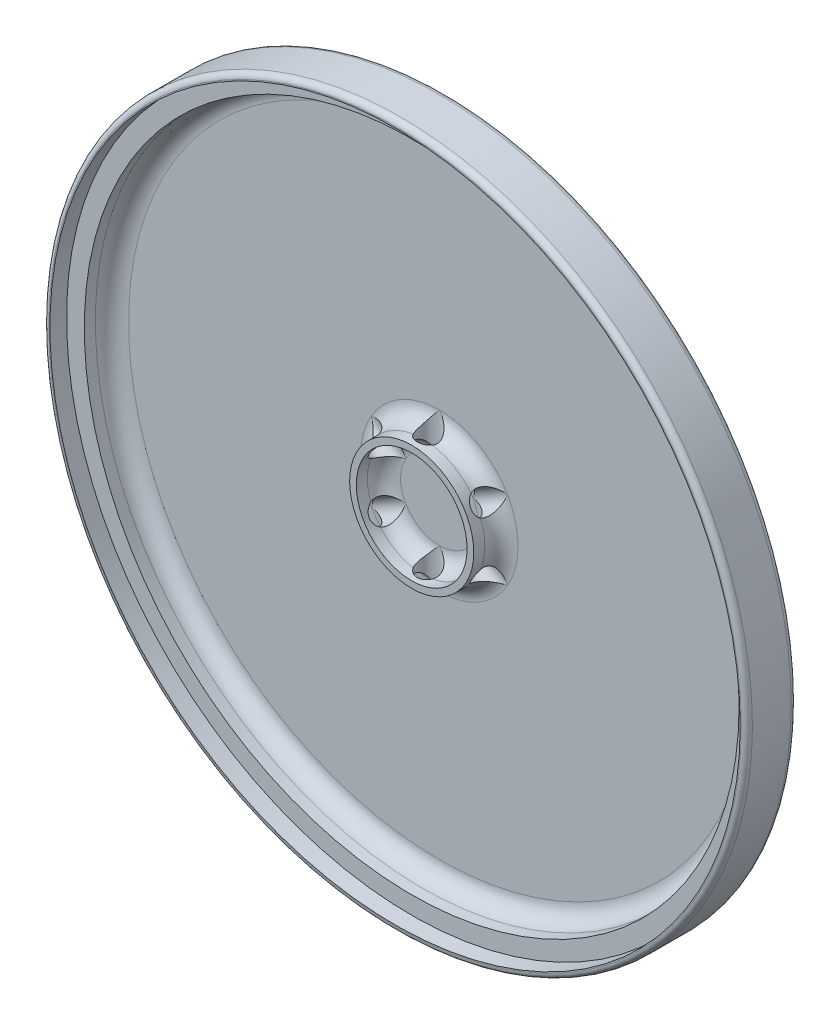
from build123d import *

# Parameters (mm, degrees)
SKETCH1_R                      = 63.5
SKETCH1_R_2                    = 62.3
SKETCH1_R_3                    = 59.1
SKETCH1_R_4                    = 11.2
SKETCH1_R_5                    = 10
BOSS_EXTRUDE1_DEPTH            = 1
BOSS_EXTRUDE2_START            = 8
SKETCH1_3_R                    = 63.5
SKETCH1_3_R_2                  = 62.3
BOSS_EXTRUDE2_DEPTH            = 8
BOSS_EXTRUDE3_START            = 5
SKETCH1_4_R                    = 62.3
SKETCH1_4_R_2                  = 59.1
BOSS_EXTRUDE3_DEPTH            = 5
SKETCH1_5_R                    = 11.2
SKETCH1_5_R_2                  = 10
BOSS_EXTRUDE4_DEPTH            = 5
CUT_EXTRUDE3_REACH             = 92.158
SKETCH2_R                      = 2
CUT_EXTRUDE3_DIRECTION_2_REACH = 92.158
FILLET1_R                      = 3
FILLET2_R                      = 3
FILLET3_R                      = 1
FILLET4_R                      = 1
CIRPATTERN1_COUNT              = 3


with BuildPart() as part:
    # Sketch1 → Boss-Extrude1 (new body)
    # profile 1 of 5: a face of its own
    with BuildSketch(Plane.XY):
        Circle(SKETCH1_R)
        Circle(SKETCH1_R_2, mode=Mode.SUBTRACT)
    # profile 2 of 5: a face of its own
    with BuildSketch(Plane.XY):
        Circle(SKETCH1_R_2)
        Circle(SKETCH1_R_3, mode=Mode.SUBTRACT)
    # profile 3 of 5: a face of its own
    with BuildSketch(Plane.XY):
        Circle(SKETCH1_R_3)
        Circle(SKETCH1_R_4, mode=Mode.SUBTRACT)
    # profile 4 of 5: a face of its own
    with BuildSketch(Plane.XY):
        Circle(SKETCH1_R_4)
        Circle(SKETCH1_R_5, mode=Mode.SUBTRACT)
    # profile 5 of 5: a face of its own
    with BuildSketch(Plane.XY):
        Circle(SKETCH1_R_5)
    extrude(amount=-BOSS_EXTRUDE1_DEPTH)

    # Sketch1<3> → Boss-Extrude2 (add)
    with BuildSketch(Plane.XY.offset(BOSS_EXTRUDE2_START)):
        Circle(SKETCH1_3_R)
        Circle(SKETCH1_3_R_2, mode=Mode.SUBTRACT)
    extrude(amount=-BOSS_EXTRUDE2_DEPTH)

    # Sketch1<4> → Boss-Extrude3 (add)
    with BuildSketch(Plane.XY.offset(BOSS_EXTRUDE3_START)):
        Circle(SKETCH1_4_R)
        Circle(SKETCH1_4_R_2, mode=Mode.SUBTRACT)
    extrude(amount=-BOSS_EXTRUDE3_DEPTH)

    # Sketch1<5> → Boss-Extrude4 (add)
    with BuildSketch(Plane.XY):
        Circle(SKETCH1_5_R)
        Circle(SKETCH1_5_R_2, mode=Mode.SUBTRACT)
    extrude(amount=BOSS_EXTRUDE4_DEPTH)

    # Sketch2 → Cut-Extrude3 (cut, up to next)
    with BuildSketch(Plane(origin=(0, 0, 0), x_dir=(1, 0, 0), z_dir=(0, 1, 0)), mode=Mode.PRIVATE) as cut_extrude3_sk1:
        with Locations(Location((0, -2, 0), (0, 0, 90))):
            Circle(SKETCH2_R)
    cut_extrude3_tool1 = extrude(cut_extrude3_sk1.sketch, amount=-CUT_EXTRUDE3_REACH, mode=Mode.PRIVATE) & part.part
    cut_extrude3 = cut_extrude3_tool1.solids().sort_by_distance((0, 0, 2))[0]
    add(cut_extrude3, mode=Mode.SUBTRACT)

    # Sketch2 → Cut-Extrude3 direction 2 (cut, up to next)
    with BuildSketch(Plane(origin=(0, 0, 0), x_dir=(1, 0, 0), z_dir=(0, 1, 0)), mode=Mode.PRIVATE) as cut_extrude3_direction_2_sk1:
        with Locations(Location((0, -2, 0), (0, 0, 90))):
            Circle(SKETCH2_R)
    cut_extrude3_direction_2_tool1 = extrude(cut_extrude3_direction_2_sk1.sketch, amount=CUT_EXTRUDE3_DIRECTION_2_REACH, mode=Mode.PRIVATE) & part.part
    cut_extrude3_direction_2 = cut_extrude3_direction_2_tool1.solids().sort_by_distance((0, 0, 2))[0]
    add(cut_extrude3_direction_2, mode=Mode.SUBTRACT)

    # Fillet1
    fillet1_edges = [part.edges().sort_by_distance(p)[0] for p in [
        (-59.1, 0, 0),
    ]]
    fillet(fillet1_edges, radius=FILLET1_R)

    # Fillet2
    # the kernel refuses this fillet: 3 mm, written as the material it adds along each edge
    with BuildSketch(Plane(origin=(0, 0, 0), x_dir=(1, 0, 0), z_dir=(0, -1, 0))) as fillet2_piece_1_section:
        with BuildLine():
            CenterArc((10 - FILLET2_R, FILLET2_R), FILLET2_R, 270, 90)
            Line((10 - FILLET2_R, 0), (10, 0))
            Line((10, 0), (10, FILLET2_R))
        make_face()
    fillet2_piece_1 = revolve(axis=Axis((0, 0, 0), (0, 0, 1)), revolution_arc=90, mode=Mode.PRIVATE)
    fillet2_piece_1 = fillet2_piece_1 - Plane(origin=(0, 6.464523556, 2), x_dir=(0, 0, -1), z_dir=(0, -1, 0)) * Cylinder(2, 40, mode=Mode.PRIVATE)
    add(fillet2_piece_1)
    with BuildSketch(Plane(origin=(0, 0, 0), x_dir=(1, 0, 0), z_dir=(0, -1, 0))) as fillet2_piece_2_section:
        with BuildLine():
            CenterArc((11.2 + FILLET2_R, FILLET2_R), FILLET2_R, 180, 90)
            Line((11.2, FILLET2_R), (11.2, 0))
            Line((11.2, 0), (11.2 + FILLET2_R, 0))
        make_face()
    fillet2_piece_2 = revolve(axis=Axis((0, 0, 0), (0, 0, 1)), revolution_arc=90, mode=Mode.PRIVATE)
    fillet2_piece_2 = fillet2_piece_2 - Plane(origin=(0, 8.524795008, 2), x_dir=(0, 0, -1), z_dir=(0, -1, 0)) * Cylinder(2, 57, mode=Mode.PRIVATE)
    add(fillet2_piece_2)
    with BuildSketch(Plane(origin=(0, 0, 0), x_dir=(0, -1, 0), z_dir=(-1, 0, 0))) as fillet2_piece_3_section:
        with BuildLine():
            CenterArc((11.2 + FILLET2_R, FILLET2_R), FILLET2_R, 180, 90)
            Line((11.2, FILLET2_R), (11.2, 0))
            Line((11.2, 0), (11.2 + FILLET2_R, 0))
        make_face()
    fillet2_piece_3 = revolve(axis=Axis((0, 0, 0), (0, 0, 1)), revolution_arc=90, mode=Mode.PRIVATE)
    fillet2_piece_3 = fillet2_piece_3 - Plane(origin=(0, -8.524795005, 2), x_dir=(0, 0, -1), z_dir=(0, 1, 0)) * Cylinder(2, 57, mode=Mode.PRIVATE)
    add(fillet2_piece_3)
    with BuildSketch(Plane(origin=(0, 0, 0), x_dir=(0, 1, 0), z_dir=(1, 0, 0))) as fillet2_piece_4_section:
        with BuildLine():
            CenterArc((11.2 + FILLET2_R, FILLET2_R), FILLET2_R, 180, 90)
            Line((11.2, FILLET2_R), (11.2, 0))
            Line((11.2, 0), (11.2 + FILLET2_R, 0))
        make_face()
    fillet2_piece_4 = revolve(axis=Axis((0, 0, 0), (0, 0, 1)), revolution_arc=180, mode=Mode.PRIVATE)
    fillet2_piece_4 = fillet2_piece_4 - Plane(origin=(0, 0, 2), x_dir=(0, 0, -1), z_dir=(0, -1, 0)) * Cylinder(2, 57, mode=Mode.PRIVATE)
    add(fillet2_piece_4)
    with BuildSketch(Plane(origin=(0, 0, 0), x_dir=(0, -1, 0), z_dir=(-1, 0, 0))) as fillet2_piece_5_section:
        with BuildLine():
            CenterArc((10 - FILLET2_R, FILLET2_R), FILLET2_R, 270, 90)
            Line((10 - FILLET2_R, 0), (10, 0))
            Line((10, 0), (10, FILLET2_R))
        make_face()
    fillet2_piece_5 = revolve(axis=Axis((0, 0, 0), (0, 0, 1)), revolution_arc=90, mode=Mode.PRIVATE)
    fillet2_piece_5 = fillet2_piece_5 - Plane(origin=(0, -6.464523543, 2), x_dir=(0, 0, -1), z_dir=(0, 1, 0)) * Cylinder(2, 40, mode=Mode.PRIVATE)
    add(fillet2_piece_5)
    with BuildSketch(Plane(origin=(0, 0, 0), x_dir=(0, 1, 0), z_dir=(1, 0, 0))) as fillet2_piece_6_section:
        with BuildLine():
            CenterArc((10 - FILLET2_R, FILLET2_R), FILLET2_R, 270, 90)
            Line((10 - FILLET2_R, 0), (10, 0))
            Line((10, 0), (10, FILLET2_R))
        make_face()
    fillet2_piece_6 = revolve(axis=Axis((0, 0, 0), (0, 0, 1)), revolution_arc=180, mode=Mode.PRIVATE)
    fillet2_piece_6 = fillet2_piece_6 - Plane(origin=(0, 0, 2), x_dir=(0, 0, -1), z_dir=(0, -1, 0)) * Cylinder(2, 40, mode=Mode.PRIVATE)
    add(fillet2_piece_6)

    # Fillet3
    fillet3_edges = [part.edges().sort_by_distance(p)[0] for p in [
        (-63.5, 0, -1),
    ]]
    fillet(fillet3_edges, radius=FILLET3_R)

    # Fillet4
    fillet4_edges = [part.edges().sort_by_distance(p)[0] for p in [
        (-63.5, 0, 8),
    ]]
    fillet(fillet4_edges, radius=FILLET4_R)

    # CirPattern1: Cut-Extrude3, Cut-Extrude3 direction 2; each copy of Cut-Extrude3, Cut-Extrude3 direction 2 runs up to whatever stops it at its own place
    cirpattern1_before = part.part  # the part as the pattern finds it: every copy runs up to it
    cirpattern1_cut_extrude3_long = extrude(cut_extrude3_sk1.sketch, amount=-CUT_EXTRUDE3_REACH, mode=Mode.PRIVATE)
    cirpattern1_cut_extrude3_tool1 = cirpattern1_cut_extrude3_long.rotate(Axis((0, 0, 5), (0, 0, -1)), 1 * 360 / CIRPATTERN1_COUNT) & cirpattern1_before
    add(cirpattern1_cut_extrude3_tool1.solids().sort_by_distance((0, 0, 2))[0], mode=Mode.SUBTRACT)
    cirpattern1_cut_extrude3_tool2 = cirpattern1_cut_extrude3_long.rotate(Axis((0, 0, 5), (0, 0, -1)), 2 * 360 / CIRPATTERN1_COUNT) & cirpattern1_before
    add(cirpattern1_cut_extrude3_tool2.solids().sort_by_distance((0, 0, 2))[0], mode=Mode.SUBTRACT)
    cirpattern1_cut_extrude3_direction_2_long = extrude(cut_extrude3_direction_2_sk1.sketch, amount=CUT_EXTRUDE3_DIRECTION_2_REACH, mode=Mode.PRIVATE)
    cirpattern1_cut_extrude3_direction_2_tool1 = cirpattern1_cut_extrude3_direction_2_long.rotate(Axis((0, 0, 5), (0, 0, -1)), 1 * 360 / CIRPATTERN1_COUNT) & cirpattern1_before
    add(cirpattern1_cut_extrude3_direction_2_tool1.solids().sort_by_distance((0, 0, 2))[0], mode=Mode.SUBTRACT)
    cirpattern1_cut_extrude3_direction_2_tool2 = cirpattern1_cut_extrude3_direction_2_long.rotate(Axis((0, 0, 5), (0, 0, -1)), 2 * 360 / CIRPATTERN1_COUNT) & cirpattern1_before
    add(cirpattern1_cut_extrude3_direction_2_tool2.solids().sort_by_distance((0, 0, 2))[0], mode=Mode.SUBTRACT)


solid = part.part
